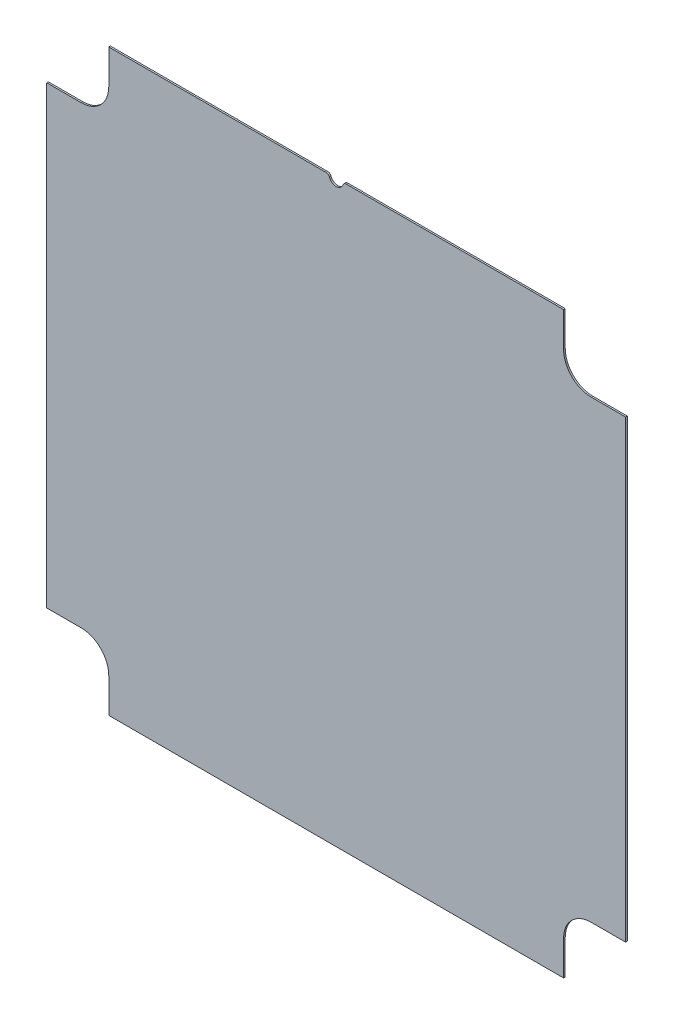
from build123d import *

# Parameters (mm, degrees)
FE_00082_OUTLINE_R = 3.3782
FE_00082_DEPTH     = 6.35
SKETCH1_W          = 5.588
SKETCH1_H          = 266.7
CUT_EXTRUDE1_DEPTH = 299.247271572
CUT_EXTRUDE2_DEPTH = 189.586918009


# Read off the part's stored shape, not the designer's step: FE-00082
with BuildPart() as part:
    # FE-00082 outline → FE-00082 (new body)
    with BuildSketch(Plane.XY):
        with BuildLine():
            Line((127, 133.35), (4.62461393, 133.35))
            ThreePointArc((4.62461393, 133.35), (3.702137995, 133.054473064), (3.123115901, 132.277922078))
            ThreePointArc((3.123115901, 132.277922078), (0, 130.048), (-3.123115901, 132.277922078))
            ThreePointArc((-3.123115901, 132.277922078), (-3.702137995, 133.054473064), (-4.62461393, 133.35))
            Line((-4.62461393, 133.35), (-127, 133.35))
            ThreePointArc((-127, 133.35), (-131.490128061, 131.490128061), (-133.35, 127))
            Line((-133.35, 127), (-133.35, -127))
            ThreePointArc((-133.35, -127), (-131.490128061, -131.490128061), (-127, -133.35))
            Line((-127, -133.35), (127, -133.35))
            ThreePointArc((127, -133.35), (131.490128061, -131.490128061), (133.35, -127))
            Line((133.35, -127), (133.35, 127))
            ThreePointArc((133.35, 127), (131.490128061, 131.490128061), (127, 133.35))
        make_face()
        with Locations((-117.475, -117.475)):
            Circle(FE_00082_OUTLINE_R, mode=Mode.SUBTRACT)
        with Locations((117.475, -117.475)):
            Circle(FE_00082_OUTLINE_R, mode=Mode.SUBTRACT)
        with Locations((-117.475, 117.475)):
            Circle(FE_00082_OUTLINE_R, mode=Mode.SUBTRACT)
        with Locations((117.475, 117.475)):
            Circle(FE_00082_OUTLINE_R, mode=Mode.SUBTRACT)
    extrude(amount=FE_00082_DEPTH)

    # Sketch1 → Cut-Extrude1 (cut, through all)
    with BuildSketch(Plane(origin=(133.35, 0, 0), x_dir=(0, 0, -1), z_dir=(1, 0, 0))):
        with Locations((-2.794, 0)):
            Rectangle(SKETCH1_W, SKETCH1_H)
    extrude(amount=-CUT_EXTRUDE1_DEPTH, mode=Mode.SUBTRACT)

    # Sketch2 → Cut-Extrude2 (cut, through all)
    with BuildSketch(Plane.XY.offset(6.35)):
        with BuildLine():
            Line((-133.35, 104.775), (-117.475, 104.775))
            ThreePointArc((-117.475, 104.775), (-108.494743879, 108.494743879), (-104.775, 117.475))
            Line((-104.775, 117.475), (-104.775, 133.35))
            Line((-104.775, 133.35), (-127, 133.35))
            ThreePointArc((-127, 133.35), (-131.490128061, 131.490128061), (-133.35, 127))
            Line((-133.35, 127), (-133.35, 104.775))
        make_face()
        with BuildLine():
            Line((-104.775, -133.35), (-127, -133.35))
            ThreePointArc((-127, -133.35), (-131.490128061, -131.490128061), (-133.35, -127))
            Line((-133.35, -127), (-133.35, -104.775))
            Line((-133.35, -104.775), (-117.475, -104.775))
            ThreePointArc((-117.475, -104.775), (-108.494743879, -108.494743879), (-104.775, -117.475))
            Line((-104.775, -117.475), (-104.775, -133.35))
        make_face()
        with BuildLine():
            Line((133.35, -104.775), (117.475, -104.775))
            ThreePointArc((117.475, -104.775), (108.494743879, -108.494743879), (104.775, -117.475))
            Line((104.775, -117.475), (104.775, -133.35))
            Line((104.775, -133.35), (127, -133.35))
            ThreePointArc((127, -133.35), (131.490128061, -131.490128061), (133.35, -127))
            Line((133.35, -127), (133.35, -104.775))
        make_face()
        with BuildLine():
            Line((104.775, 133.35), (127, 133.35))
            ThreePointArc((127, 133.35), (131.490128061, 131.490128061), (133.35, 127))
            Line((133.35, 127), (133.35, 104.775))
            Line((133.35, 104.775), (117.475, 104.775))
            ThreePointArc((117.475, 104.775), (108.494743879, 108.494743879), (104.775, 117.475))
            Line((104.775, 117.475), (104.775, 133.35))
        make_face()
    extrude(amount=-CUT_EXTRUDE2_DEPTH, mode=Mode.SUBTRACT)


solid = part.part
